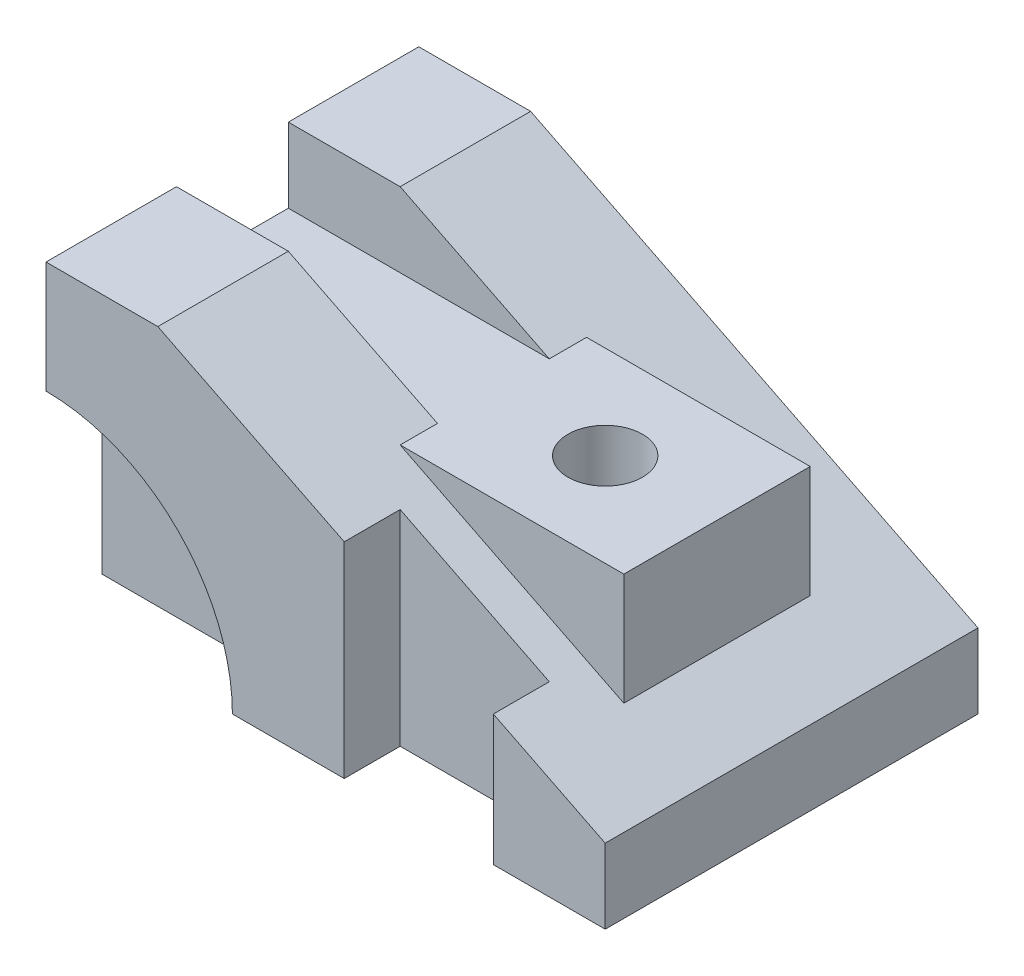
from build123d import *

# Parameters (mm, degrees)
BOSS_EXTRUDE1_DEPTH      = 50
BOSS_EXTRUDE1_DEPTH_BACK = 50
SKETCH3_R                = 50
CUT_EXTRUDE1_DEPTH       = 15
BOSS_EXTRUDE2_DEPTH      = 25
BOSS_EXTRUDE2_DEPTH_BACK = 25
SKETCH5_W                = 160.565172102
SKETCH5_H                = 30
CUT_EXTRUDE2_DEPTH       = 170.115345253
SKETCH6_R                = 10
CUT_EXTRUDE3_DEPTH       = 170.115345253
SKETCH7_W                = 40
SKETCH7_H                = 15
CUT_EXTRUDE4_DEPTH       = 178.200451467


with BuildPart() as part:
    # Sketch1 → Boss-Extrude1 (new, two sides: drawn at the far end of the back side and taken through both)
    with BuildSketch(Plane.XY.offset(-BOSS_EXTRUDE1_DEPTH_BACK)):
        Polygon((0, 0), (150, 0), (150, 20), (30, 80), (0, 80), align=None)
    extrude(amount=BOSS_EXTRUDE1_DEPTH + BOSS_EXTRUDE1_DEPTH_BACK)

    # Sketch3 → Cut-Extrude1 (cut)
    with BuildSketch(Plane.XY.offset(50)):
        Circle(SKETCH3_R)
    extrude(amount=-CUT_EXTRUDE1_DEPTH, mode=Mode.SUBTRACT)

    # Sketch4 → Boss-Extrude2 (add, two sides: drawn at the far end of the back side and taken through both)
    with BuildSketch(Plane.XY.offset(-BOSS_EXTRUDE2_DEPTH_BACK)):
        with BuildLine():
            Line((70, 60), (130, 60))
            Line((130, 60), (130, 30))
            Line((130, 30), (150, 20))
            Line((150, 20), (150, 0))
            Line((150, 0), (50, 0))
            ThreePointArc((50, 0), (35.355339059, 35.355339059), (0, 50))
            Line((0, 50), (0, 80))
            Line((0, 80), (30, 80))
            Line((30, 80), (70, 60))
        make_face()
    extrude(amount=BOSS_EXTRUDE2_DEPTH + BOSS_EXTRUDE2_DEPTH_BACK)

    # Sketch5 → Cut-Extrude2 (cut, through all)
    with BuildSketch(Plane(origin=(0, 60, 0), x_dir=(1, 0, 0), z_dir=(0, 1, 0))):
        with Locations((37.442570887, 0)):
            Rectangle(SKETCH5_W, SKETCH5_H)
    extrude(amount=CUT_EXTRUDE2_DEPTH, mode=Mode.SUBTRACT)

    # Sketch6 → Cut-Extrude3 (cut, through all)
    with BuildSketch(Plane(origin=(0, 60, 0), x_dir=(1, 0, 0), z_dir=(0, 1, 0))):
        with Locations((100, 0)):
            Circle(SKETCH6_R)
    extrude(amount=-CUT_EXTRUDE3_DEPTH, mode=Mode.SUBTRACT)

    # Sketch7 → Cut-Extrude4 (cut, through all)
    with BuildSketch(Plane.XZ):
        with Locations((100, 42.5)):
            Rectangle(SKETCH7_W, SKETCH7_H)
    extrude(amount=-CUT_EXTRUDE4_DEPTH, mode=Mode.SUBTRACT)


solid = part.part
